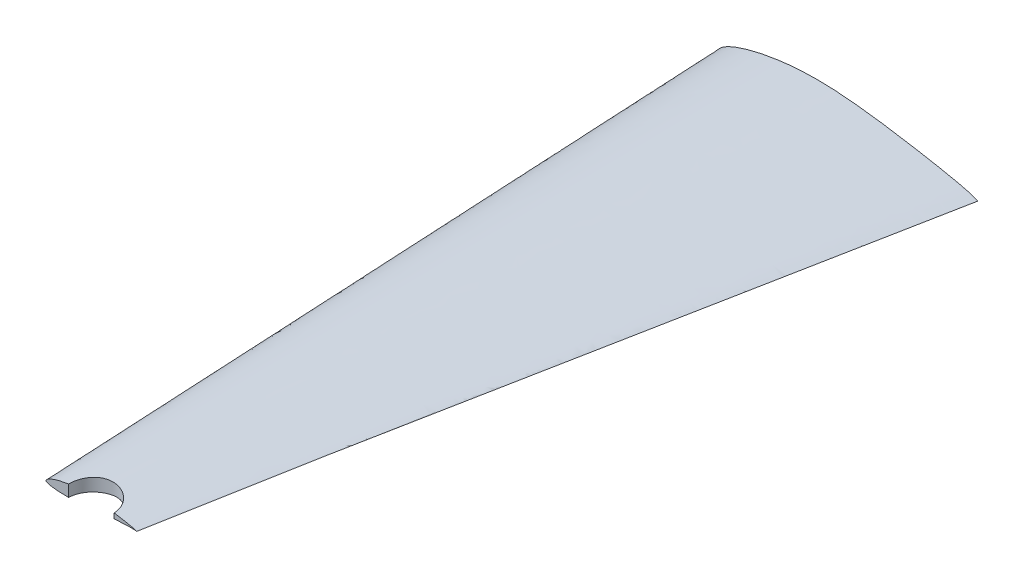
from build123d import *

# Parameters (mm, degrees)
SKETCH9_W           = 153.025181843
SKETCH9_H           = 114.223926853
BOSS_EXTRUDE1_DEPTH = 30
SKETCH13_R          = 200
CUT_EXTRUDE3_DEPTH  = 9300


with BuildPart() as part:
    # Loft5: read off the stored shape, not the designer's step
    # Loft5: loft between two sections, ruled curve by curve
    loft5_from = [
        Edge.make_bspline([(-829.212772497, 127.551706357, 0), (-831.317274891, 127.061718607, 0), (-844.668148264, 123.928740686, 0), (-872.329771939, 117.109052219, 0), (-906.646678697, 107.793584513, 0), (-943.80675307, 96.706282111, 0), (-972.975630231, 87.133596036, 0), (-1007.056661139, 74.800467806, 0), (-1030.665167222, 65.371687304, 0), (-1061.251311385, 51.696229701, 0), (-1079.007221144, 42.808632271, 0), (-1104.056348403, 28.406825452, 0), (-1117.409319776, 19.763642688, 0), (-1135.661709212, 5.372212741, 0), (-1144.515334401, -2.76604107, 0), (-1152.824664261, -12.775534115, 0), (-1156.436856109, -17.898520897, 0), (-1159.789487128, -23.909048657, 0), (-1161.961165575, -29.098752305, 0), (-1162.898772566, -33.888692217, 0), (-1162.722322656, -37.246430416, 0), (-1161.376410185, -40.405163539, 0), (-1159.101061336, -43.341445224, 0), (-1156.169648214, -46.360268456, 0), (-1153.913610018, -48.325076325, 0), (-1149.037863286, -52.229824068, 0), (-1144.904465379, -54.873739693, 0), (-1138.918168667, -58.2614101, 0), (-1135.409125373, -60.114894418, 0), (-1131.086153496, -62.184117695, 0), (-1128.062749348, -63.552116154, 0), (-1124.957966743, -64.902605897, 0), (-1121.733410812, -66.233544346, 0), (-1117.820438188, -67.774740949, 0), (-1110.816309962, -70.417875078, 0), (-1097.913469259, -74.794649303, 0), (-1085.242602625, -78.392314228, 0), (-1064.043847197, -83.894313067, 0), (-1047.315496568, -87.539615236, 0), (-1017.117187521, -93.260495205, 0), (-994.512717815, -96.924455589, 0), (-959.517300941, -101.820414141, 0), (-930.120025114, -105.403442174, 0), (-891.724704525, -109.432084325, 0), (-856.001094532, -112.660371668, 0), (-814.532681306, -115.819272508, 0), (-773.108617956, -118.46019236, 0), (-728.921749645, -120.727861062, 0), (-682.487865336, -122.589459116, 0), (-635.955138153, -123.896306526, 0), (-585.260805311, -124.716877102, 0), (-536.786168999, -124.870489109, 0), (-482.492900731, -124.307536975, 0), (-432.360602341, -123.075537446, 0), (-374.939789857, -120.848489139, 0), (-323.370046071, -118.090444143, 0), (-263.150854917, -113.99486438, 0), (-210.284693563, -109.672068592, 0), (-147.384354845, -103.796961064, 0), (-93.209248624, -98.245085126, 0), (-27.830451447, -91.283325291, 0), (27.454015847, -85.244242969, 0), (94.536215974, -77.893849451, 0), (150.39908442, -71.81267181, 0), (218.052527081, -64.624948902, 0), (273.920887846, -58.869058971, 0), (340.938588876, -52.252940051, 0), (396.199038728, -47.078911228, 0), (461.320625474, -41.411227612, 0), (515.337224218, -37.086128159, 0), (577.258841301, -32.619053172, 0), (629.366984439, -29.282013497, 0), (686.772059362, -26.121169414, 0), (736.32883914, -23.863508643, 0), (788.002218715, -22.08100638, 0), (834.381396591, -20.969016588, 0), (878.996349976, -20.394696271, 0), (921.647415287, -20.369424901, 0), (958.504069283, -20.876496332, 0), (996.654106057, -21.799806632, 0), (1023.598056722, -22.716367439, 0), (1057.024719476, -24.623742059, 0), (1077.499981305, -26.264632795, 0), (1096.514340268, -27.566782518, 0), (1105.67791724, -28.280245159, 0), (1126.629467928, -31.787482376, 0), (1116.860258711, -29.204675117, 0), (1103.491455609, -25.345372413, 0), (1097.045245428, -22.784584734, 0), (1087.42865464, -19.254695703, 0), (1081.046641164, -16.983065882, 0), (1071.065638587, -13.548629979, 0), (1060.508198045, -10.056396018, 0), (1041.501846956, -4.011755255, 0), (1027.267729689, 0.144425406, 0), (1001.62865514, 7.087391456, 0), (982.966051304, 11.664428987, 0), (950.144604936, 19.245814605, 0), (924.339173662, 24.953084517, 0), (887.987857285, 32.691699437, 0), (855.221667661, 39.456253619, 0), (815.432732419, 47.436061284, 0), (776.394699371, 55.078042811, 0), (733.635824341, 63.242248164, 0), (689.09132049, 71.554958692, 0), (643.736426124, 79.820771828, 0), (594.501021823, 88.597113467, 0), (546.979513719, 96.853397495, 0), (493.926468036, 105.814553336, 0), (444.688425496, 113.877854678, 0), (388.704102795, 122.751431019, 0), (338.176625069, 130.462695339, 0), (280.153653465, 138.938776244, 0), (228.796399932, 146.066997244, 0), (169.620247767, 153.793957674, 0), (117.8495197, 160.094803785, 0), (58.371499933, 166.752946042, 0), (6.613894095, 171.982487207, 0), (-52.350409868, 177.19161356, 0), (-103.707599495, 180.989927105, 0), (-161.504174793, 184.272167029, 0), (-212.18503492, 186.250098279, 0), (-268.376964457, 187.366353469, 0), (-318.189108737, 187.369099053, 0), (-372.466520975, 186.211013679, 0), (-421.229723555, 184.136770997, 0), (-473.348885587, 180.784630174, 0), (-520.928345689, 176.749110039, 0), (-570.605287005, 171.553982266, 0), (-616.78200539, 165.855506715, 0), (-663.514068565, 159.219359753, 0), (-707.942171735, 152.063883731, 0), (-751.094306198, 144.229303286, 0), (-791.304100998, 136.103996798, 0), (-816.926871374, 130.412212037, 0), (-829.212772497, 127.551706357, 0)], [0, 0, 0, 0, 0.001389313, 0.008817328, 0.018317328, 0.024249235, 0.033749235, 0.038050758, 0.047550758, 0.050086992, 0.059586992, 0.060298396, 0.068662508, 0.069798396, 0.075196821, 0.076355027, 0.078162508, 0.079210607, 0.080771243, 0.081759988, 0.082324933, 0.082903368, 0.083935007, 0.084696821, 0.08560475, 0.085855027, 0.088710607, 0.088745281, 0.090271243, 0.091259988, 0.091824933, 0.092403368, 0.093435007, 0.094065408, 0.09510475, 0.098245281, 0.102821682, 0.103565408, 0.112321682, 0.113824926, 0.123324926, 0.127043205, 0.136543205, 0.142365824, 0.151865824, 0.159606169, 0.169106169, 0.178554979, 0.188054979, 0.198986583, 0.208486583, 0.220654823, 0.230154823, 0.243397979, 0.252897979, 0.267102846, 0.276602846, 0.291707475, 0.301207475, 0.317224202, 0.326724202, 0.343484356, 0.352984356, 0.370117039, 0.379617039, 0.3967311, 0.4062311, 0.422919301, 0.432419301, 0.448263223, 0.457763223, 0.472337171, 0.481837171, 0.494734876, 0.504234876, 0.515067169, 0.524567169, 0.532973464, 0.542473464, 0.548115275, 0.557615275, 0.560239006, 0.569117917, 0.569739006, 0.574561052, 0.5764, 0.578180254, 0.578617917, 0.583176619, 0.584061052, 0.5859, 0.587680254, 0.590707632, 0.592676619, 0.600207632, 0.600446247, 0.609946247, 0.612516403, 0.622016403, 0.626946973, 0.636446973, 0.643529884, 0.653029884, 0.662024429, 0.671524429, 0.682167292, 0.691667292, 0.703682098, 0.713182098, 0.726264114, 0.735764114, 0.74962976, 0.75912976, 0.773469078, 0.782969078, 0.797503034, 0.807003034, 0.821451957, 0.830951957, 0.84506318, 0.85456318, 0.868172798, 0.877672798, 0.890698508, 0.900198508, 0.912577511, 0.922077511, 0.933777359, 0.943277359, 0.95419167, 0.96369167, 0.973624888, 0.983124888, 0.991889313, 1, 1, 1, 1], 3),
    ]
    loft5_to = [
        Edge.make_bspline([(-729.582389456, 13.403805311, 6200), (-730.318211722, 13.238348565, 6200), (-734.98649761, 12.180942787, 6200), (-744.66247192, 9.886964265, 6200), (-756.675221699, 6.770524912, 6200), (-769.701597857, 3.093513865, 6200), (-779.941039136, -0.05877316, 6200), (-791.937939175, -4.073504277, 6200), (-800.271635923, -7.114097709, 6200), (-811.137073166, -11.433971487, 6200), (-817.485959529, -14.19456714, 6200), (-826.581899049, -18.557067843, 6200), (-831.501072742, -21.127209764, 6200), (-838.462484808, -25.246287729, 6200), (-841.975859972, -27.509371787, 6200), (-845.654984774, -30.176591122, 6200), (-847.387479055, -31.504072044, 6200), (-849.254612158, -33.019459167, 6200), (-850.738397936, -34.299081324, 6200), (-851.981208618, -35.450593648, 6200), (-852.81195744, -36.258654397, 6200), (-853.643168007, -37.098398304, 6200), (-854.522834035, -38.038824986, 6200), (-855.486598587, -39.143425162, 6200), (-856.144369435, -39.951804386, 6200), (-857.470291301, -41.682556994, 6200), (-858.399044101, -43.126554736, 6200), (-859.437447764, -45.292435097, 6200), (-859.951652512, -46.585094986, 6200), (-860.250483794, -48.243008279, 6200), (-860.171358916, -49.413931298, 6200), (-859.685133378, -50.509291448, 6200), (-858.920544702, -51.46604271, 6200), (-857.890282721, -52.51274062, 6200), (-855.899412614, -54.210877329, 6200), (-851.845410917, -56.738617721, 6200), (-847.631826927, -58.591481927, 6200), (-840.476286073, -61.294767411, 6200), (-834.724461756, -62.945601924, 6200), (-824.291101711, -65.451606173, 6200), (-816.441328873, -66.973721147, 6200), (-804.264962227, -68.934536156, 6200), (-794.016105144, -70.292979192, 6200), (-780.624231997, -71.788910349, 6200), (-768.15823144, -72.952015434, 6200), (-753.685229768, -74.065867066, 6200), (-739.225029965, -74.968204536, 6200), (-723.800256947, -75.720503999, 6200), (-707.59066002, -76.309738655, 6200), (-691.347393324, -76.703765359, 6200), (-673.652310294, -76.920958508, 6200), (-656.732725681, -76.915239558, 6200), (-637.783141412, -76.660005077, 6200), (-620.28657042, -76.175627428, 6200), (-600.247094685, -75.335952801, 6200), (-582.250512499, -74.314957468, 6200), (-561.236484634, -72.814658427, 6200), (-542.791640178, -71.218916422, 6200), (-520.849100672, -69.035328801, 6200), (-501.958483833, -66.92672383, 6200), (-479.169318703, -64.222617868, 6200), (-459.902845381, -61.856842079, 6200), (-436.529026608, -58.946691598, 6200), (-417.066692699, -56.516875483, 6200), (-393.498661069, -53.611404802, 6200), (-374.03645908, -51.263140683, 6200), (-350.690306424, -48.532951986, 6200), (-331.439751589, -46.363488637, 6200), (-308.753293046, -43.93747608, 6200), (-289.934159161, -42.045489335, 6200), (-268.359116036, -40.035462323, 6200), (-250.199918116, -38.480736838, 6200), (-230.190766005, -36.936212469, 6200), (-212.91889373, -35.747522114, 6200), (-194.910643233, -34.687055333, 6200), (-178.727987445, -33.896785804, 6200), (-163.142037505, -33.300869727, 6200), (-148.295180486, -32.878505974, 6200), (-135.510280925, -32.668243988, 6200), (-122.064312898, -32.610547727, 6200), (-112.41237929, -32.676095179, 6200), (-101.185621164, -32.839242744, 6200), (-94.694191826, -33.009619549, 6200), (-86.646997526, -33.381934733, 6200), (-82.437547294, -33.623039531, 6200), (-77.887637836, -33.892326878, 6200), (-75.836489586, -34.010750741, 6200), (-72.598003768, -34.189053211, 6200), (-70.178258635, -34.301668596, 6200), (-65.130926277, -34.952280468, 6200), (-61.219968316, -35.546922275, 6200), (-66.827943541, -34.153745823, 6200), (-70.308987126, -33.04414093, 6200), (-75.598263023, -31.116558633, 6200), (-81.045792296, -29.345647125, 6200), (-90.319570234, -26.507163426, 6200), (-96.595904047, -24.750384373, 6200), (-107.88502428, -21.957778239, 6200), (-116.957770808, -19.954032435, 6200), (-129.689332313, -17.290409799, 6200), (-141.121593196, -15.011777611, 6200), (-155.022712636, -12.343362224, 6200), (-168.679885661, -9.806925635, 6200), (-183.635091475, -7.108962462, 6200), (-199.211125486, -4.374114881, 6200), (-215.071766812, -1.663516138, 6200), (-232.290856731, 1.205102467, 6200), (-248.908737025, 3.903029265, 6200), (-267.458845846, 6.830098193, 6200), (-284.67394302, 9.459710916, 6200), (-304.246471706, 12.348521858, 6200), (-321.909051, 14.859760629, 6200), (-342.189067406, 17.620147222, 6200), (-360.136717598, 19.943970403, 6200), (-380.81354783, 22.464574829, 6200), (-398.900387153, 24.520166576, 6200), (-419.676785549, 26.691326162, 6200), (-437.753077169, 28.405097583, 6200), (-458.342023145, 30.120547388, 6200), (-476.271878737, 31.390704448, 6200), (-496.445788386, 32.511818091, 6200), (-514.135464419, 33.198221005, 6200), (-533.747761807, 33.602932118, 6200), (-551.134229476, 33.637210802, 6200), (-570.079752186, 33.291176346, 6200), (-587.102435635, 32.626327338, 6200), (-605.298537547, 31.527055863, 6200), (-621.909929147, 30.172193525, 6200), (-639.254057596, 28.403654796, 6200), (-655.375965402, 26.451894064, 6200), (-671.691690803, 24.168932191, 6200), (-687.207071999, 21.722041351, 6200), (-702.280533154, 19.055363782, 6200), (-716.330842904, 16.297550032, 6200), (-725.286723349, 14.369727336, 6200), (-729.582389456, 13.403805311, 6200)], [0, 0, 0, 0, 0.001389313, 0.008817328, 0.018317328, 0.024249235, 0.033749235, 0.038050758, 0.047550758, 0.050086992, 0.059586992, 0.060298396, 0.068662508, 0.069798396, 0.075196821, 0.076355027, 0.078162508, 0.079210607, 0.080771243, 0.081759988, 0.082324933, 0.082903368, 0.083935007, 0.084696821, 0.08560475, 0.085855027, 0.088710607, 0.088745281, 0.090271243, 0.091259988, 0.091824933, 0.092403368, 0.093435007, 0.094065408, 0.09510475, 0.098245281, 0.102821682, 0.103565408, 0.112321682, 0.113824926, 0.123324926, 0.127043205, 0.136543205, 0.142365824, 0.151865824, 0.159606169, 0.169106169, 0.178554979, 0.188054979, 0.198986583, 0.208486583, 0.220654823, 0.230154823, 0.243397979, 0.252897979, 0.267102846, 0.276602846, 0.291707475, 0.301207475, 0.317224202, 0.326724202, 0.343484356, 0.352984356, 0.370117039, 0.379617039, 0.3967311, 0.4062311, 0.422919301, 0.432419301, 0.448263223, 0.457763223, 0.472337171, 0.481837171, 0.494734876, 0.504234876, 0.515067169, 0.524567169, 0.532973464, 0.542473464, 0.548115275, 0.557615275, 0.560239006, 0.569117917, 0.569739006, 0.574561052, 0.5764, 0.578180254, 0.578617917, 0.583176619, 0.584061052, 0.5859, 0.587680254, 0.590707632, 0.592676619, 0.600207632, 0.600446247, 0.609946247, 0.612516403, 0.622016403, 0.626946973, 0.636446973, 0.643529884, 0.653029884, 0.662024429, 0.671524429, 0.682167292, 0.691667292, 0.703682098, 0.713182098, 0.726264114, 0.735764114, 0.74962976, 0.75912976, 0.773469078, 0.782969078, 0.797503034, 0.807003034, 0.821451957, 0.830951957, 0.84506318, 0.85456318, 0.868172798, 0.877672798, 0.890698508, 0.900198508, 0.912577511, 0.922077511, 0.933777359, 0.943277359, 0.95419167, 0.96369167, 0.973624888, 0.983124888, 0.991889313, 1, 1, 1, 1], 3),
    ]
    loft5 = Solid(Shell([*[Face.make_surface_from_curves(loft5_from[k], loft5_to[k]) for k in range(1)], Face(Wire(loft5_from)), Face(Wire(loft5_to))]))
    add(loft5)

    # Sketch9 → Boss-Extrude1 (add)
    with BuildSketch(Plane(origin=(0, 0, 0), x_dir=(-1, 0, 0), z_dir=(0, 0, -1))):
        with Locations((590.106894295, 40.833916784)):
            Rectangle(SKETCH9_W, SKETCH9_H)
    extrude(amount=BOSS_EXTRUDE1_DEPTH)

    # Sketch13 → Cut-Extrude3 (cut)
    with BuildSketch(Plane(origin=(-2172.474712708, -6356.51367508, -7372.816109292), x_dir=(1, 0, 0), z_dir=(0, 1, 0))):
        with Locations((1710.986148181, -13572.816109292)):
            Circle(SKETCH13_R)
    extrude(amount=CUT_EXTRUDE3_DEPTH, mode=Mode.SUBTRACT)


solid = part.part
